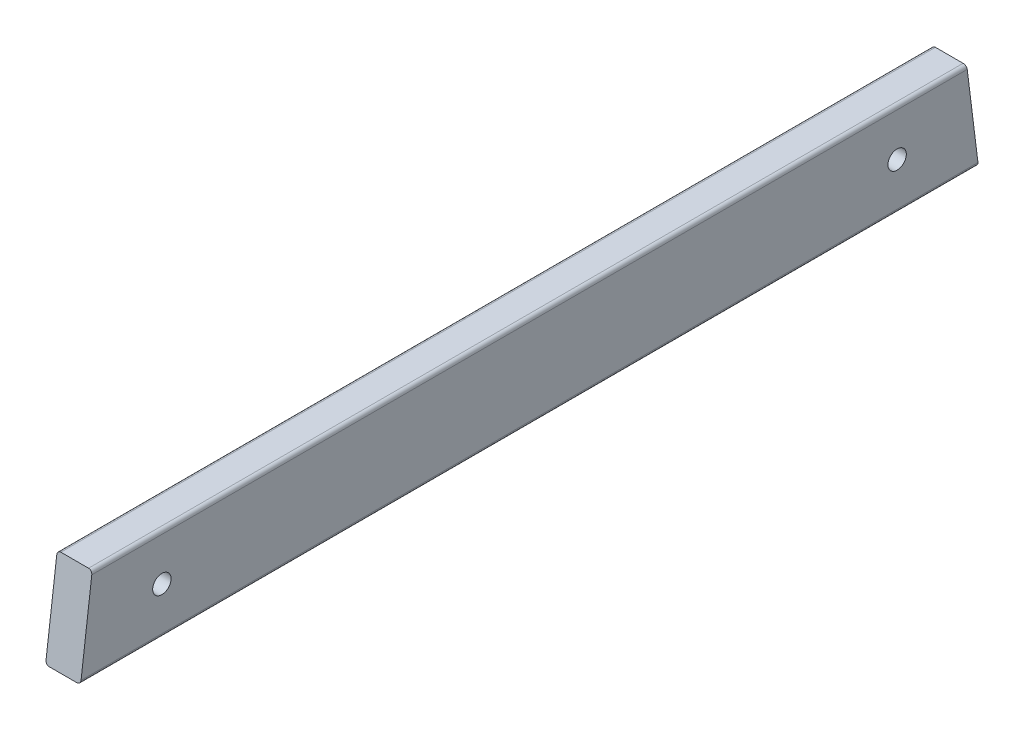
from build123d import *

# Parameters (mm, degrees)
ESBO_O1_W                 = 9.525
ESBO_O1_H                 = 25.4
RESSALTO_EXTRUS_O1_DEPTH  = 210
FILETE1_R                 = 1
CORTE_EXTRUS_O1_START     = -9.525
CORTE_EXTRUS_O1_DEPTH     = 9.525
FURO_ROSCADO_DE_M6X1_01_D = 5


# Read off the part's stored shape, not the designer's step: Corte-extrusão1
with BuildPart() as part:
    # Esboço1 → Ressalto-extrusão1 (new, symmetric)
    with BuildSketch(Plane.XY):
        Rectangle(ESBO_O1_W, ESBO_O1_H)
    extrude(amount=RESSALTO_EXTRUS_O1_DEPTH, both=True)

    # Filete1
    filete1_edges = [part.edges().sort_by_distance(p)[0] for p in [
        (4.7625, -12.7, 0),
        (-4.7625, -12.7, 0),
        (-4.7625, 12.7, 0),
        (4.7625, 12.7, 0),
    ]]
    fillet(filete1_edges, radius=FILETE1_R)

    # Corte-extrusão1 outline → Corte-extrusão1 (cut)
    with BuildSketch(Plane.ZY.offset(4.7625).offset(CORTE_EXTRUS_O1_START)):
        Polygon((118.94, 12.7), (122.111992176, -12.7), (210, -12.7), (210, 12.7), align=None)
        Polygon((-210, -12.7), (-122.111992176, -12.7), (-118.94, 12.7), (-210, 12.7), align=None)
    extrude(amount=CORTE_EXTRUS_O1_DEPTH, mode=Mode.SUBTRACT)

    # Furo roscado de M6x1.01 (through all)
    with Locations(Plane.ZY.offset(4.7625)):
        with Locations((-100, 0), (100, 0)):
            Hole(FURO_ROSCADO_DE_M6X1_01_D / 2)


solid = part.part
